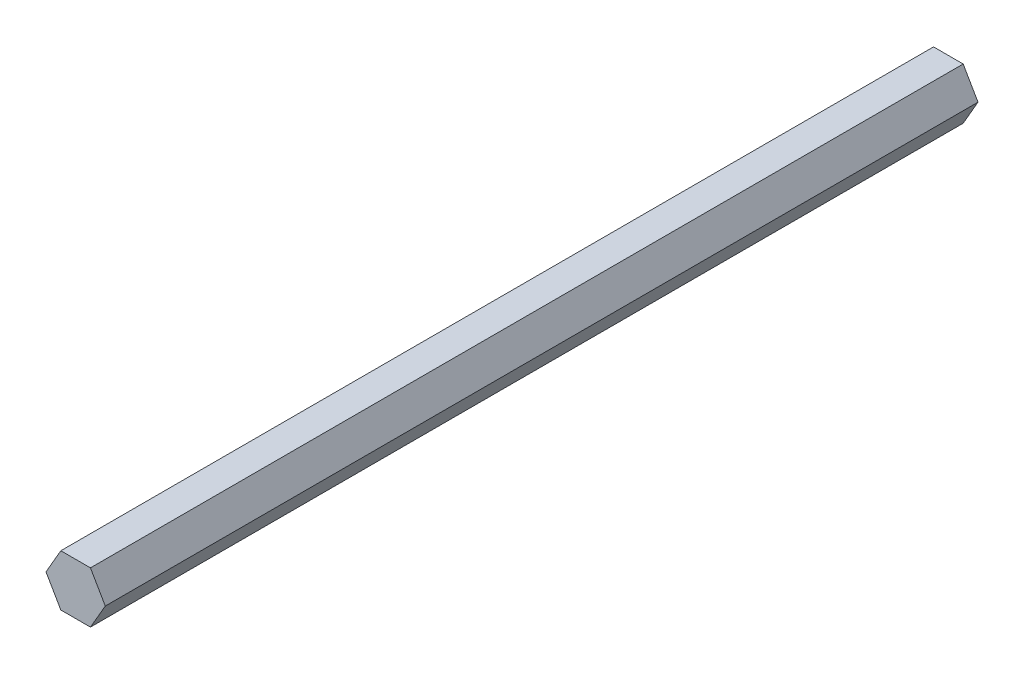
from build123d import *

# Parameters (mm, degrees)
BOSS_EXTRUDE1_DEPTH = 215.9


with BuildPart() as part:
    # Sketch1 → Boss-Extrude1 (new body)
    with BuildSketch(Plane.XY):
        Polygon((-7.332348419, 0), (-3.666174209, -6.35), (3.666174209, -6.35), (7.332348419, 0), (3.666174209, 6.35), (-3.666174209, 6.35), align=None)
    extrude(amount=BOSS_EXTRUDE1_DEPTH)


solid = part.part
